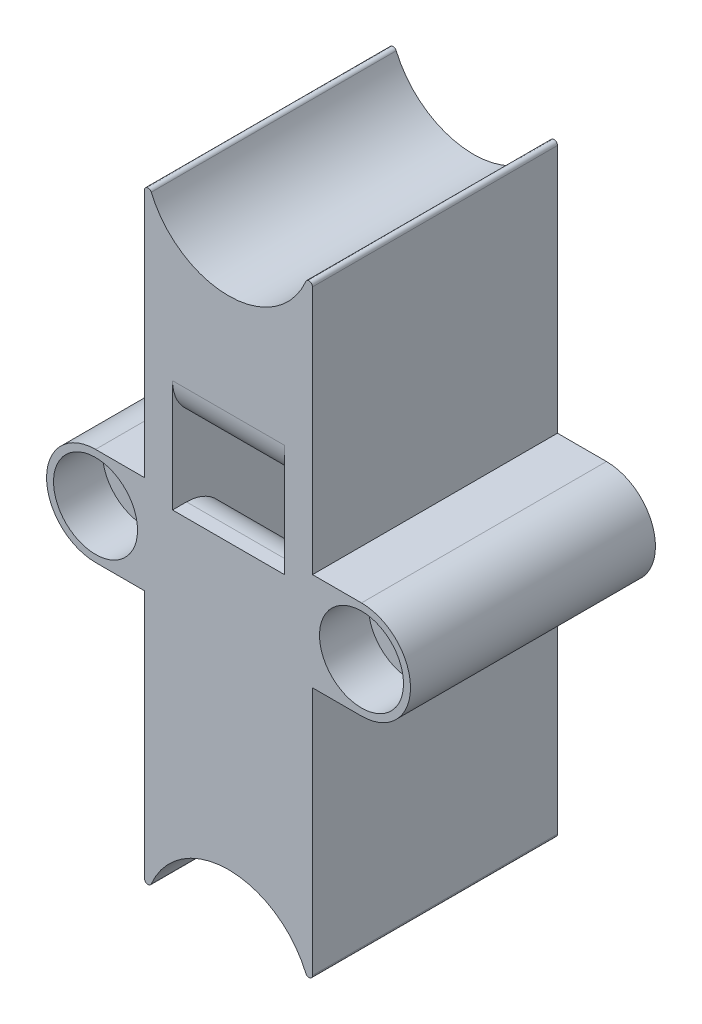
from build123d import *

# Parameters (mm, degrees)
SKETCH1_R                       = 1.65
BOSS_EXTRUDE1_DEPTH             = 17.5
FILLET1_R                       = 0.25
SKIZZE1_W                       = 8
SKIZZE1_H                       = 5
SCHNITT_LINEAR_AUSTRAGEN1_DEPTH = 8
SKIZZE2_W                       = 8
SKIZZE2_H                       = 4
SCHNITT_LINEAR_AUSTRAGEN2_DEPTH = 10
VERRUNDUNG1_R                   = 3
SKIZZE3_R                       = 3
SCHNITT_LINEAR_AUSTRAGEN3_DEPTH = 3.5


with BuildPart() as part:
    # Sketch1 → Boss-Extrude1 (new body)
    with BuildSketch(Plane.XY):
        with BuildLine():
            Line((-6, -3.5), (-6, -23.75))
            ThreePointArc((-6, -23.75), (0, -17.75), (6, -23.75))
            Line((6, -23.75), (6, -3.5))
            Line((6, -3.5), (9.5, -3.5))
            ThreePointArc((9.5, -3.5), (13, 0), (9.5, 3.5))
            Line((9.5, 3.5), (6, 3.5))
            Line((6, 3.5), (6, 23.75))
            ThreePointArc((6, 23.75), (0, 17.75), (-6, 23.75))
            Line((-6, 23.75), (-6, 3.5))
            Line((-6, 3.5), (-9.5, 3.5))
            ThreePointArc((-9.5, 3.5), (-13, 0), (-9.5, -3.5))
            Line((-9.5, -3.5), (-6, -3.5))
        make_face()
        with Locations((-9.5, 0)):
            Circle(SKETCH1_R, mode=Mode.SUBTRACT)
        with Locations((9.5, 0)):
            Circle(SKETCH1_R, mode=Mode.SUBTRACT)
    extrude(amount=BOSS_EXTRUDE1_DEPTH)

    # Fillet1
    fillet1_edges = [part.edges().sort_by_distance(p)[0] for p in [
        (6, -23.75, 8.75),
        (6, 23.75, 8.75),
        (-6, 23.75, 8.75),
    ]]
    fillet(fillet1_edges, radius=FILLET1_R)
    fillet1_2_edges = [part.edges().sort_by_distance(p)[0] for p in [
        (-6, -23.75, 8.75),
    ]]
    fillet(fillet1_2_edges, radius=FILLET1_R)

    # Skizze1 → Schnitt-Linear austragen1 (cut)
    with BuildSketch(Plane.XY.offset(17.5)):
        with Locations((0, 5)):
            Rectangle(SKIZZE1_W, SKIZZE1_H)
    extrude(amount=-SCHNITT_LINEAR_AUSTRAGEN1_DEPTH, mode=Mode.SUBTRACT)

    # Skizze2 → Schnitt-Linear austragen2 (cut)
    with BuildSketch(Plane(origin=(0, 2.5, 0), x_dir=(1, 0, 0), z_dir=(0, 1, 0))):
        with Locations((0, -11.5)):
            Rectangle(SKIZZE2_W, SKIZZE2_H)
    extrude(amount=-SCHNITT_LINEAR_AUSTRAGEN2_DEPTH, mode=Mode.SUBTRACT)

    # Verrundung1
    verrundung1_edges = [part.edges().sort_by_distance(p)[0] for p in [
        (0, 7.5, 17.5),
        (0, 2.5, 13.5),
    ]]
    fillet(verrundung1_edges, radius=VERRUNDUNG1_R)

    # Skizze3 → Schnitt-Linear austragen3 (cut)
    with BuildSketch(Plane.XY.offset(17.5)):
        with Locations((-9.5, 0)):
            Circle(SKIZZE3_R)
        with Locations((9.5, 0)):
            Circle(SKIZZE3_R)
    extrude(amount=-SCHNITT_LINEAR_AUSTRAGEN3_DEPTH, mode=Mode.SUBTRACT)


solid = part.part
